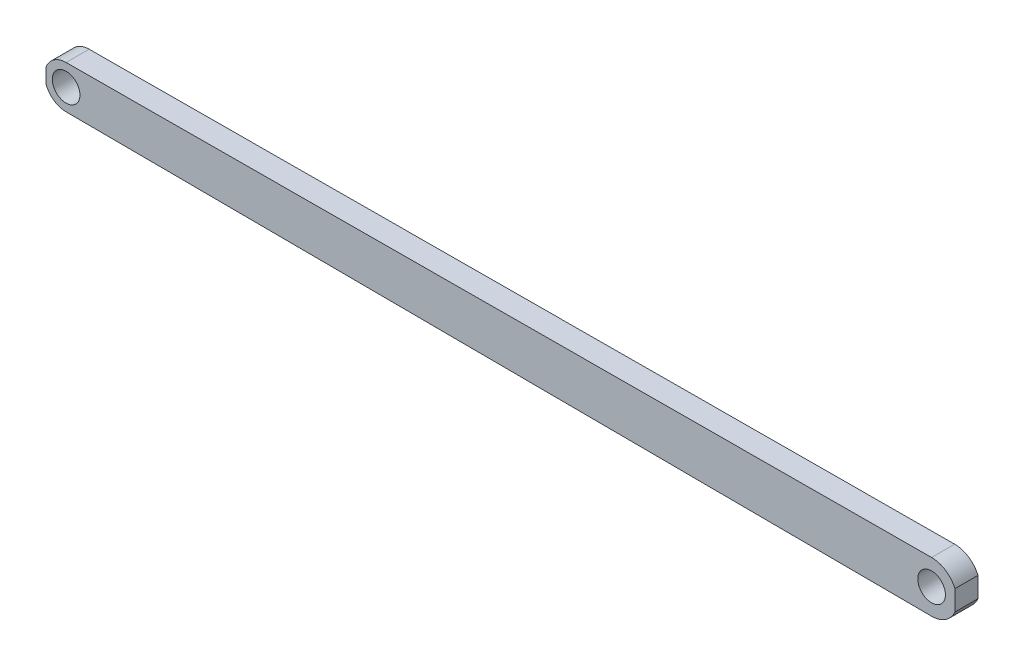
from build123d import *

# Parameters (mm, degrees)
DODANIE_WYCI_GNI_CIE1_OUTLINE_R = 3.000000079
DODANIE_WYCI_GNI_CIE1_DEPTH     = 5
SZKIC2_W                        = 1.618528634
SZKIC2_H                        = 4.134107934
SZKIC2_H_2                      = 3.371537851
SZKIC2_W_2                      = 0.651830256
SZKIC2_H_3                      = 2.48709631
SZKIC2_H_4                      = 2.564588173
WYTNIJ_WYCI_GNI_CIE3_DEPTH      = 194.428536027


# Read off the part's stored shape, not the designer's step: Dodanie-wyciągnięcie1
with BuildPart() as part:
    # Dodanie-wyciągnięcie1 outline → Dodanie-wyciągnięcie1 (new body)
    with BuildSketch(Plane.XY):
        with BuildLine():
            Line((187.7624, 5.522620658), (0, 4.635188213))
            ThreePointArc((0, 4.635188213), (-4.635188213, 0), (0, -4.635188213))
            Line((0, -4.635188213), (187.7624, -5.522620658))
            ThreePointArc((187.7624, -5.522620658), (193.285020658, 0), (187.7624, 5.522620658))
        make_face()
        Circle(DODANIE_WYCI_GNI_CIE1_OUTLINE_R, mode=Mode.SUBTRACT)
        with Locations((187.7624, 0)):
            Circle(DODANIE_WYCI_GNI_CIE1_OUTLINE_R, mode=Mode.SUBTRACT)
    extrude(amount=DODANIE_WYCI_GNI_CIE1_DEPTH)

    # Szkic2 → Wytnij-wyciągnięcie3 (cut, through all)
    with BuildSketch(Plane.XY):
        with Locations((193.638606269, 2.067053967)):
            Rectangle(SZKIC2_W, SZKIC2_H)
        with Locations((193.638606269, -1.685768926)):
            Rectangle(SZKIC2_W, SZKIC2_H_2)
        with Locations((-4.682734605, 1.243548155)):
            Rectangle(SZKIC2_W_2, SZKIC2_H_3)
        with Locations((-4.682734605, -1.282294087)):
            Rectangle(SZKIC2_W_2, SZKIC2_H_4)
    extrude(amount=WYTNIJ_WYCI_GNI_CIE3_DEPTH, mode=Mode.SUBTRACT)


solid = part.part
